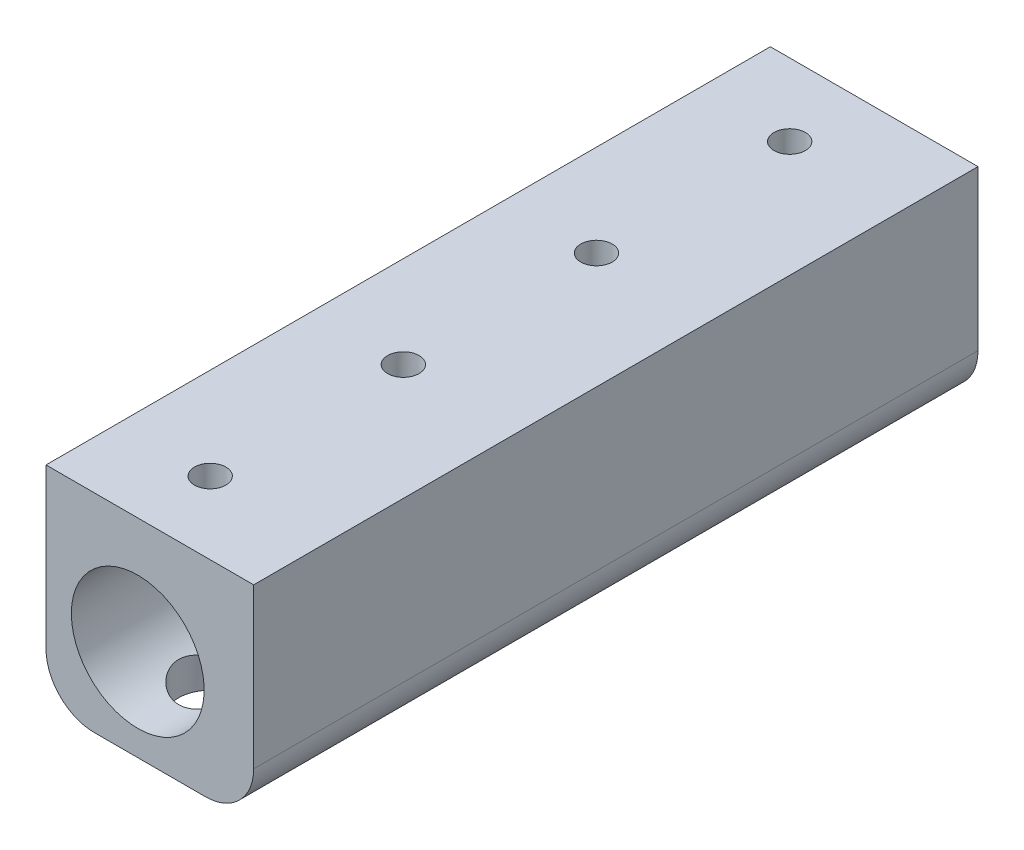
from build123d import *

# Parameters (mm, degrees)
SKETCH1_W               = 38
SKETCH1_H               = 48
SKETCH1_R               = 13.75
SKETCH1_H_2             = 10
BOSS_EXTRUDE1_DEPTH     = 230
SKETCH3_R               = 6
CUT_EXTRUDE1_DEPTH      = 0.5
SKETCH4_R               = 3.25
CUT_EXTRUDE2_DEPTH      = 239.706179225
CUT_EXTRUDE3_REACH      = 240.706
CUT_EXTRUDE3_END_RADIUS = 13.75
SKETCH5_R               = 6.5
CUT_EXTRUDE4_REACH      = 243.178
CUT_EXTRUDE4_END_RADIUS = 13.75
CUT_EXTRUDE4_START      = -5
CHAMFER1_SIZE           = 5
SKETCH8_W               = 230
SKETCH8_H               = 1.2
CUT_EXTRUDE6_DEPTH      = 10
SKETCH9_W               = 43
SKETCH9_H               = 80
CUT_EXTRUDE7_DEPTH      = 237.177899168
SKETCH10_W              = 43
SKETCH10_H              = 5
CUT_EXTRUDE8_DEPTH      = 154.792067529
FILLET1_R               = 10


with BuildPart() as part:
    # Sketch1 → Boss-Extrude1 (new body)
    # profile 1 of 3: a face of its own
    with BuildSketch(Plane.XY):
        Rectangle(SKETCH1_W, SKETCH1_H)
        Circle(SKETCH1_R, mode=Mode.SUBTRACT)
    # profile 2 of 3: a face of its own
    with BuildSketch(Plane.XY):
        with Locations((0, 30.2)):
            Rectangle(SKETCH1_W, SKETCH1_H_2)
    # profile 3 of 3: a face of its own
    with BuildSketch(Plane.XY):
        Polygon((19, 24), (19, -24), (24, -24), (24, 35.2), (19, 35.2), (19, 25.2), align=None)
    extrude(amount=BOSS_EXTRUDE1_DEPTH)

    # Sketch3 → Cut-Extrude1 (cut)
    with BuildSketch(Plane(origin=(0, 35.2, 0), x_dir=(1, 0, 0), z_dir=(0, 1, 0))):
        with Locations(Location((0, -15, 0), (0, 0, 270))):
            Circle(SKETCH3_R)
        with Locations(Location((0, -55, 0), (0, 0, 270))):
            Circle(SKETCH3_R)
        with Locations(Location((0, -95, 0), (0, 0, 270))):
            Circle(SKETCH3_R)
        with Locations(Location((0, -135, 0), (0, 0, 270))):
            Circle(SKETCH3_R)
        with Locations(Location((0, -175, 0), (0, 0, 270))):
            Circle(SKETCH3_R)
        with Locations(Location((0, -215, 0), (0, 0, 270))):
            Circle(SKETCH3_R)
    extrude(amount=-CUT_EXTRUDE1_DEPTH, mode=Mode.SUBTRACT)

    # Sketch4 → Cut-Extrude2 (cut, through all)
    with BuildSketch(Plane(origin=(0, 35.2, 0), x_dir=(1, 0, 0), z_dir=(0, 1, 0))):
        with Locations(Location((0, -15, 0), (0, 0, 270))):
            Circle(SKETCH4_R)
        with Locations(Location((0, -55, 0), (0, 0, 270))):
            Circle(SKETCH4_R)
        with Locations(Location((0, -95, 0), (0, 0, 270))):
            Circle(SKETCH4_R)
        with Locations(Location((0, -135, 0), (0, 0, 270))):
            Circle(SKETCH4_R)
        with Locations(Location((0, -175, 0), (0, 0, 270))):
            Circle(SKETCH4_R)
        with Locations(Location((0, -215, 0), (0, 0, 270))):
            Circle(SKETCH4_R)
    extrude(amount=-CUT_EXTRUDE2_DEPTH, mode=Mode.SUBTRACT)

    # Cut-Extrude3: up to this cylinder (the profile starts outside it)
    cut_extrude3_end = Plane(origin=(0, 0, 115), z_dir=(0, 0, -1)) * Cylinder(CUT_EXTRUDE3_END_RADIUS, 709.912, mode=Mode.PRIVATE)
    # Sketch5 → Cut-Extrude3 (cut, up to the surface)
    with BuildSketch(Plane.XZ.offset(24), mode=Mode.PRIVATE) as cut_extrude3_sk1:
        with Locations(Location((0, 215, 0), (0, 0, 270))):
            Circle(SKETCH5_R)
    cut_extrude3_tool1 = extrude(cut_extrude3_sk1.sketch, amount=-CUT_EXTRUDE3_REACH, mode=Mode.PRIVATE) - cut_extrude3_end
    add(cut_extrude3_tool1.solids().sort_by_distance((0, -24, 215))[0], mode=Mode.SUBTRACT)
    # Sketch5 → Cut-Extrude3 (cut, up to the surface)
    with BuildSketch(Plane.XZ.offset(24), mode=Mode.PRIVATE) as cut_extrude3_sk2:
        with Locations(Location((0, 175, 0), (0, 0, 270))):
            Circle(SKETCH5_R)
    cut_extrude3_tool2 = extrude(cut_extrude3_sk2.sketch, amount=-CUT_EXTRUDE3_REACH, mode=Mode.PRIVATE) - cut_extrude3_end
    add(cut_extrude3_tool2.solids().sort_by_distance((0, -24, 175))[0], mode=Mode.SUBTRACT)
    # Sketch5 → Cut-Extrude3 (cut, up to the surface)
    with BuildSketch(Plane.XZ.offset(24), mode=Mode.PRIVATE) as cut_extrude3_sk3:
        with Locations(Location((0, 135, 0), (0, 0, 270))):
            Circle(SKETCH5_R)
    cut_extrude3_tool3 = extrude(cut_extrude3_sk3.sketch, amount=-CUT_EXTRUDE3_REACH, mode=Mode.PRIVATE) - cut_extrude3_end
    add(cut_extrude3_tool3.solids().sort_by_distance((0, -24, 135))[0], mode=Mode.SUBTRACT)
    # Sketch5 → Cut-Extrude3 (cut, up to the surface)
    with BuildSketch(Plane.XZ.offset(24), mode=Mode.PRIVATE) as cut_extrude3_sk4:
        with Locations(Location((0, 95, 0), (0, 0, 270))):
            Circle(SKETCH5_R)
    cut_extrude3_tool4 = extrude(cut_extrude3_sk4.sketch, amount=-CUT_EXTRUDE3_REACH, mode=Mode.PRIVATE) - cut_extrude3_end
    add(cut_extrude3_tool4.solids().sort_by_distance((0, -24, 95))[0], mode=Mode.SUBTRACT)
    # Sketch5 → Cut-Extrude3 (cut, up to the surface)
    with BuildSketch(Plane.XZ.offset(24), mode=Mode.PRIVATE) as cut_extrude3_sk5:
        with Locations(Location((0, 55, 0), (0, 0, 270))):
            Circle(SKETCH5_R)
    cut_extrude3_tool5 = extrude(cut_extrude3_sk5.sketch, amount=-CUT_EXTRUDE3_REACH, mode=Mode.PRIVATE) - cut_extrude3_end
    add(cut_extrude3_tool5.solids().sort_by_distance((0, -24, 55))[0], mode=Mode.SUBTRACT)
    # Sketch5 → Cut-Extrude3 (cut, up to the surface)
    with BuildSketch(Plane.XZ.offset(24), mode=Mode.PRIVATE) as cut_extrude3_sk6:
        with Locations(Location((0, 15, 0), (0, 0, 270))):
            Circle(SKETCH5_R)
    cut_extrude3_tool6 = extrude(cut_extrude3_sk6.sketch, amount=-CUT_EXTRUDE3_REACH, mode=Mode.PRIVATE) - cut_extrude3_end
    add(cut_extrude3_tool6.solids().sort_by_distance((0, -24, 15))[0], mode=Mode.SUBTRACT)

    # Cut-Extrude4: up to this cylinder (the profile starts outside it)
    cut_extrude4_end = Plane(origin=(0, 0, 115), z_dir=(0, 0, -1)) * Cylinder(CUT_EXTRUDE4_END_RADIUS, 714.856, mode=Mode.PRIVATE)
    # Sketch7 → Cut-Extrude4 (cut, up to the surface)
    with BuildSketch(Plane(origin=(0, 24, 0), x_dir=(1, 0, 0), z_dir=(0, 1, 0)).offset(CUT_EXTRUDE4_START), mode=Mode.PRIVATE) as cut_extrude4_sk1:
        Polygon((0, -8.533676985), (-5.6, -11.766838493), (-5.6, -18.233161507), (0, -21.466323015), (5.6, -18.233161507), (5.6, -11.766838493), align=None)
    cut_extrude4_tool1 = extrude(cut_extrude4_sk1.sketch, amount=-CUT_EXTRUDE4_REACH, mode=Mode.PRIVATE) - cut_extrude4_end
    add(cut_extrude4_tool1.solids().sort_by_distance((0, 19, 15))[0], mode=Mode.SUBTRACT)
    # Sketch7 → Cut-Extrude4 (cut, up to the surface)
    with BuildSketch(Plane(origin=(0, 24, 0), x_dir=(1, 0, 0), z_dir=(0, 1, 0)).offset(CUT_EXTRUDE4_START), mode=Mode.PRIVATE) as cut_extrude4_sk2:
        Polygon((0, -48.533676985), (-5.6, -51.766838493), (-5.6, -58.233161507), (0, -61.466323015), (5.6, -58.233161507), (5.6, -51.766838493), align=None)
    cut_extrude4_tool2 = extrude(cut_extrude4_sk2.sketch, amount=-CUT_EXTRUDE4_REACH, mode=Mode.PRIVATE) - cut_extrude4_end
    add(cut_extrude4_tool2.solids().sort_by_distance((0, 19, 55))[0], mode=Mode.SUBTRACT)
    # Sketch7 → Cut-Extrude4 (cut, up to the surface)
    with BuildSketch(Plane(origin=(0, 24, 0), x_dir=(1, 0, 0), z_dir=(0, 1, 0)).offset(CUT_EXTRUDE4_START), mode=Mode.PRIVATE) as cut_extrude4_sk3:
        Polygon((0, -88.533676985), (-5.6, -91.766838493), (-5.6, -98.233161507), (0, -101.466323015), (5.6, -98.233161507), (5.6, -91.766838493), align=None)
    cut_extrude4_tool3 = extrude(cut_extrude4_sk3.sketch, amount=-CUT_EXTRUDE4_REACH, mode=Mode.PRIVATE) - cut_extrude4_end
    add(cut_extrude4_tool3.solids().sort_by_distance((0, 19, 95))[0], mode=Mode.SUBTRACT)
    # Sketch7 → Cut-Extrude4 (cut, up to the surface)
    with BuildSketch(Plane(origin=(0, 24, 0), x_dir=(1, 0, 0), z_dir=(0, 1, 0)).offset(CUT_EXTRUDE4_START), mode=Mode.PRIVATE) as cut_extrude4_sk4:
        Polygon((0, -128.533676985), (-5.6, -131.766838493), (-5.6, -138.233161507), (0, -141.466323015), (5.6, -138.233161507), (5.6, -131.766838493), align=None)
    cut_extrude4_tool4 = extrude(cut_extrude4_sk4.sketch, amount=-CUT_EXTRUDE4_REACH, mode=Mode.PRIVATE) - cut_extrude4_end
    add(cut_extrude4_tool4.solids().sort_by_distance((0, 19, 135))[0], mode=Mode.SUBTRACT)
    # Sketch7 → Cut-Extrude4 (cut, up to the surface)
    with BuildSketch(Plane(origin=(0, 24, 0), x_dir=(1, 0, 0), z_dir=(0, 1, 0)).offset(CUT_EXTRUDE4_START), mode=Mode.PRIVATE) as cut_extrude4_sk5:
        Polygon((0, -168.533676985), (-5.6, -171.766838493), (-5.6, -178.233161507), (0, -181.466323015), (5.6, -178.233161507), (5.6, -171.766838493), align=None)
    cut_extrude4_tool5 = extrude(cut_extrude4_sk5.sketch, amount=-CUT_EXTRUDE4_REACH, mode=Mode.PRIVATE) - cut_extrude4_end
    add(cut_extrude4_tool5.solids().sort_by_distance((0, 19, 175))[0], mode=Mode.SUBTRACT)
    # Sketch7 → Cut-Extrude4 (cut, up to the surface)
    with BuildSketch(Plane(origin=(0, 24, 0), x_dir=(1, 0, 0), z_dir=(0, 1, 0)).offset(CUT_EXTRUDE4_START), mode=Mode.PRIVATE) as cut_extrude4_sk6:
        Polygon((0, -208.533676985), (-5.6, -211.766838493), (-5.6, -218.233161507), (0, -221.466323015), (5.6, -218.233161507), (5.6, -211.766838493), align=None)
    cut_extrude4_tool6 = extrude(cut_extrude4_sk6.sketch, amount=-CUT_EXTRUDE4_REACH, mode=Mode.PRIVATE) - cut_extrude4_end
    add(cut_extrude4_tool6.solids().sort_by_distance((0, 19, 215))[0], mode=Mode.SUBTRACT)

    # Chamfer1
    # the kernel refuses this chamfer: 5 mm, written as the material it takes off along each edge
    with BuildSketch(Plane(origin=(0, 34.7, 215), x_dir=(0, 0, 1), z_dir=(-1, 0, 0))) as chamfer1_piece_1_section:
        Polygon((3.25, -CHAMFER1_SIZE), (3.25 + CHAMFER1_SIZE, 0), (3.25, 0), align=None)
    chamfer1_piece_1 = revolve(axis=Axis((0, 34.7, 215), (0, 1, 0)), mode=Mode.PRIVATE)
    chamfer1_piece_1 = chamfer1_piece_1 & Plane(origin=(0, 31.051548399, 215), x_dir=(0, 0, 1), z_dir=(0, 1, 0)) * Cylinder(6, 33, mode=Mode.PRIVATE)
    add(chamfer1_piece_1, mode=Mode.SUBTRACT)
    with BuildSketch(Plane(origin=(0, 34.7, 175), x_dir=(0, 0, 1), z_dir=(-1, 0, 0))) as chamfer1_piece_2_section:
        Polygon((3.25, -CHAMFER1_SIZE), (3.25 + CHAMFER1_SIZE, 0), (3.25, 0), align=None)
    chamfer1_piece_2 = revolve(axis=Axis((0, 34.7, 175), (0, 1, 0)), mode=Mode.PRIVATE)
    chamfer1_piece_2 = chamfer1_piece_2 & Plane(origin=(0, 31.051548399, 175), x_dir=(0, 0, 1), z_dir=(0, 1, 0)) * Cylinder(6, 33, mode=Mode.PRIVATE)
    add(chamfer1_piece_2, mode=Mode.SUBTRACT)
    with BuildSketch(Plane(origin=(0, 34.7, 135), x_dir=(0, 0, 1), z_dir=(-1, 0, 0))) as chamfer1_piece_3_section:
        Polygon((3.25, -CHAMFER1_SIZE), (3.25 + CHAMFER1_SIZE, 0), (3.25, 0), align=None)
    chamfer1_piece_3 = revolve(axis=Axis((0, 34.7, 135), (0, 1, 0)), mode=Mode.PRIVATE)
    chamfer1_piece_3 = chamfer1_piece_3 & Plane(origin=(0, 31.051548399, 135), x_dir=(0, 0, 1), z_dir=(0, 1, 0)) * Cylinder(6, 33, mode=Mode.PRIVATE)
    add(chamfer1_piece_3, mode=Mode.SUBTRACT)
    with BuildSketch(Plane(origin=(0, 34.7, 95), x_dir=(0, 0, 1), z_dir=(-1, 0, 0))) as chamfer1_piece_4_section:
        Polygon((3.25, -CHAMFER1_SIZE), (3.25 + CHAMFER1_SIZE, 0), (3.25, 0), align=None)
    chamfer1_piece_4 = revolve(axis=Axis((0, 34.7, 95), (0, 1, 0)), mode=Mode.PRIVATE)
    chamfer1_piece_4 = chamfer1_piece_4 & Plane(origin=(0, 31.051548399, 95), x_dir=(0, 0, 1), z_dir=(0, 1, 0)) * Cylinder(6, 33, mode=Mode.PRIVATE)
    add(chamfer1_piece_4, mode=Mode.SUBTRACT)
    with BuildSketch(Plane(origin=(0, 34.7, 55), x_dir=(0, 0, 1), z_dir=(-1, 0, 0))) as chamfer1_piece_5_section:
        Polygon((3.25, -CHAMFER1_SIZE), (3.25 + CHAMFER1_SIZE, 0), (3.25, 0), align=None)
    chamfer1_piece_5 = revolve(axis=Axis((0, 34.7, 55), (0, 1, 0)), mode=Mode.PRIVATE)
    chamfer1_piece_5 = chamfer1_piece_5 & Plane(origin=(0, 31.051548399, 55), x_dir=(0, 0, 1), z_dir=(0, 1, 0)) * Cylinder(6, 33, mode=Mode.PRIVATE)
    add(chamfer1_piece_5, mode=Mode.SUBTRACT)
    with BuildSketch(Plane(origin=(0, 34.7, 15), x_dir=(0, 0, 1), z_dir=(-1, 0, 0))) as chamfer1_piece_6_section:
        Polygon((3.25, -CHAMFER1_SIZE), (3.25 + CHAMFER1_SIZE, 0), (3.25, 0), align=None)
    chamfer1_piece_6 = revolve(axis=Axis((0, 34.7, 15), (0, 1, 0)), mode=Mode.PRIVATE)
    chamfer1_piece_6 = chamfer1_piece_6 & Plane(origin=(0, 31.051548399, 15), x_dir=(0, 0, 1), z_dir=(0, 1, 0)) * Cylinder(6, 33, mode=Mode.PRIVATE)
    add(chamfer1_piece_6, mode=Mode.SUBTRACT)

    # Sketch8 → Cut-Extrude6 (cut)
    with BuildSketch(Plane.ZY.offset(-19)):
        with Locations((115, 24.6)):
            Rectangle(SKETCH8_W, SKETCH8_H)
    extrude(amount=-CUT_EXTRUDE6_DEPTH, mode=Mode.SUBTRACT)


with BuildPart() as cut_extrude6_kept_piece:
    # of the separate pieces the step leaves, the one the design keeps (cut_extrude6_pieces_kept)
    add(part.part.solids().sort_by_distance((-19, -24, 0))[0])

    # Sketch9 → Cut-Extrude7 (cut, through all)
    with BuildSketch(Plane(origin=(0, 24, 0), x_dir=(1, 0, 0), z_dir=(0, 1, 0))):
        with Locations((2.5, -190)):
            Rectangle(SKETCH9_W, SKETCH9_H)
    extrude(amount=-CUT_EXTRUDE7_DEPTH, mode=Mode.SUBTRACT)

    # Sketch10 → Cut-Extrude8 (cut, through all)
    with BuildSketch(Plane(origin=(0, 0, 0), x_dir=(-1, 0, 0), z_dir=(0, 0, -1))):
        with Locations((-2.5, -21.5)):
            Rectangle(SKETCH10_W, SKETCH10_H)
    extrude(amount=-CUT_EXTRUDE8_DEPTH, mode=Mode.SUBTRACT)

    # Fillet1
    fillet1_edges = [cut_extrude6_kept_piece.edges().sort_by_distance(p)[0] for p in [
        (24, -19, 75),
        (-19, -19, 75),
    ]]
    fillet(fillet1_edges, radius=FILLET1_R)


solid = cut_extrude6_kept_piece.part
